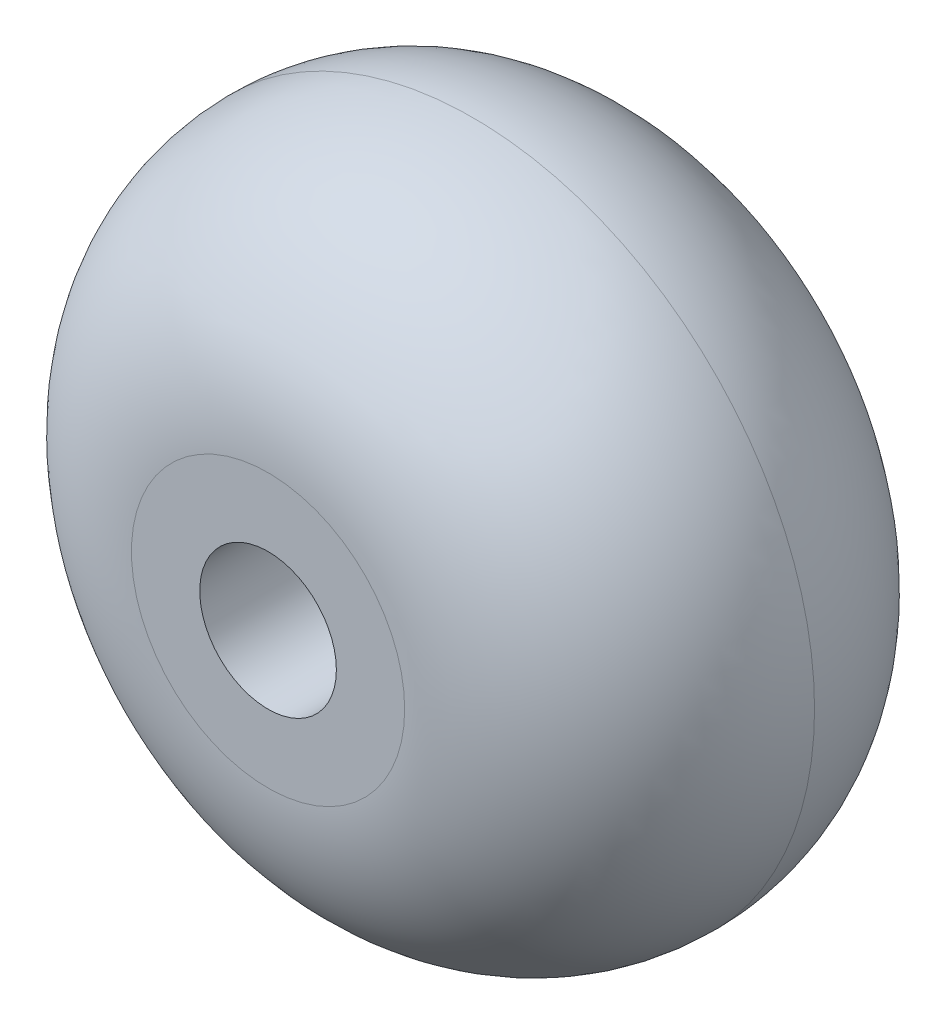
from build123d import *

# Parameters (mm, degrees)
SZKIC1_R                    = 25
DODANIE_WYCI_GNI_CIE1_DEPTH = 30
SZKIC2_R                    = 5
WYTNIJ_WYCI_GNI_CIE1_DEPTH  = 30
ZAOKR_GLENIE1_R             = 15


with BuildPart() as part:
    # Szkic1 → Dodanie-wyciągnięcie1 (new body)
    with BuildSketch(Plane.XY):
        Circle(SZKIC1_R)
    extrude(amount=DODANIE_WYCI_GNI_CIE1_DEPTH)

    # Szkic2 → Wytnij-wyciągnięcie1 (cut)
    with BuildSketch(Plane.XY.offset(30)):
        Circle(SZKIC2_R)
    extrude(amount=-WYTNIJ_WYCI_GNI_CIE1_DEPTH, mode=Mode.SUBTRACT)

    # Zaokrąglenie1
    zaokr_glenie1_edges = [part.edges().sort_by_distance(p)[0] for p in [
        (-25, 0, 0),
        (-25, 0, 30),
    ]]
    fillet(zaokr_glenie1_edges, radius=ZAOKR_GLENIE1_R - 0.0001)  # a hair under: the kernel refuses the full size


solid = part.part
